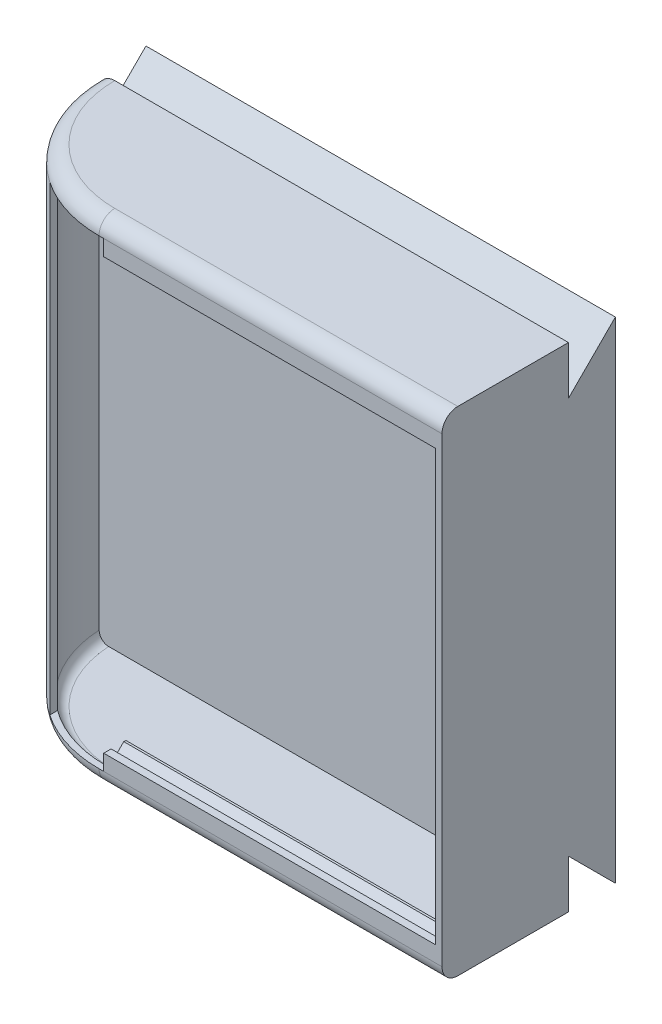
from build123d import *

# Parameters (mm, degrees)
SKETCH1_W            = 148.500856602
SKETCH1_H            = 156
BOSS_EXTRUDE1_DEPTH  = 40
FILLET3_R            = 40
FILLET4_R            = 5
SHELL4_T             = -2
SKETCH19_W           = 131
SKETCH19_H           = 146
CUT_EXTRUDE8_DEPTH   = 10
SKETCH21_W           = 107
SKETCH21_H           = 2
BOSS_EXTRUDE7_DEPTH  = 5
BOSS_EXTRUDE8_START  = -107
BOSS_EXTRUDE8_DEPTH  = 107
CUT_EXTRUDE9_DEPTH   = 107
BOSS_EXTRUDE9_DEPTH  = 2
BOSS_EXTRUDE10_DEPTH = 15
CUT_EXTRUDE10_DEPTH  = 170
SHELL5_START         = -57.680419874
SHELL5_DEPTH         = 103
SKETCH29_W           = 7.658063704
SKETCH29_H           = 119.773909492
CUT_EXTRUDE11_DEPTH  = 170
SKETCH31_W           = 7.658063704
SKETCH31_H           = 119.773909492
BOSS_EXTRUDE12_DEPTH = 2
SKETCH32_W           = 7.658063704
SKETCH32_H           = 119.773909492
BOSS_EXTRUDE13_DEPTH = 2
CUT_EXTRUDE12_DEPTH  = 154


# Read off the part's stored shape, not the designer's step: Shell5
# Some blends are built 0.0001 mm under size
with BuildPart() as part:
    # Sketch1 → Boss-Extrude1 (new body)
    with BuildSketch(Plane.XY):
        with Locations((-26.930848175, -80)):
            Rectangle(SKETCH1_W, SKETCH1_H)
    extrude(amount=BOSS_EXTRUDE1_DEPTH)

    # Fillet3
    fillet3_edges = [part.edges().sort_by_distance(p)[0] for p in [
        (-101.181276476, -80, 40),
    ]]
    fillet(fillet3_edges, radius=FILLET3_R - 0.0001)  # a hair under: the kernel refuses the full size

    # Fillet4
    # the kernel refuses this fillet: 5 mm, written as the material it takes off along each edge
    with BuildSketch(Plane(origin=(-61.181376476, -158, 40), x_dir=(0, 1, 0), z_dir=(1, 0, 0))) as fillet4_piece_1:
        with BuildLine():
            CenterArc((FILLET4_R, -FILLET4_R), FILLET4_R, 90, 90)
            Line((0, -FILLET4_R), (0, 0))
            Line((0, 0), (FILLET4_R, 0))
        make_face()
    extrude(amount=121.000956602, mode=Mode.SUBTRACT)
    with BuildSketch(Plane(origin=(-61.181376476, -158, 0.0001), x_dir=(-1, 0, 0), z_dir=(0, 0, -1))) as fillet4_piece_2:
        with BuildLine():
            CenterArc((39.9999 - FILLET4_R, FILLET4_R), FILLET4_R, 270, 90)
            Line((39.9999 - FILLET4_R, 0), (39.9999, 0))
            Line((39.9999, 0), (39.9999, FILLET4_R))
        make_face()
    revolve(axis=Axis((-61.181376476, -158, 0.0001), (0, 1, 0)), revolution_arc=90, mode=Mode.SUBTRACT)
    with BuildSketch(Plane(origin=(-61.181376476, -2, 0.0001), x_dir=(-1, 0, 0), z_dir=(0, 0, -1))) as fillet4_piece_3:
        with BuildLine():
            CenterArc((39.9999 - FILLET4_R, -FILLET4_R), FILLET4_R, 0, 90)
            Line((39.9999, -FILLET4_R), (39.9999, 0))
            Line((39.9999, 0), (39.9999 - FILLET4_R, 0))
        make_face()
    revolve(axis=Axis((-61.181376476, -2, 0.0001), (0, 1, 0)), revolution_arc=90, mode=Mode.SUBTRACT)
    with BuildSketch(Plane(origin=(59.819580126, -2, 40), x_dir=(0, 0, -1), z_dir=(-1, 0, 0))) as fillet4_piece_4:
        with BuildLine():
            CenterArc((FILLET4_R, FILLET4_R), FILLET4_R, 180, 90)
            Line((0, FILLET4_R), (0, 0))
            Line((0, 0), (FILLET4_R, 0))
        make_face()
    extrude(amount=121.000956602, mode=Mode.SUBTRACT)
    with BuildSketch(Plane(origin=(-101.181276476, -2, -12.5), x_dir=(1, 0, 0), z_dir=(0, 0, 1)), Plane(origin=(-101.181276476, -158, -12.5), x_dir=(0, 1, 0), z_dir=(0, 0, 1))) as fillet4_piece_5:
        with BuildLine():
            CenterArc((FILLET4_R, -FILLET4_R), FILLET4_R, 90, 90)
            Line((0, -FILLET4_R), (0, 0))
            Line((0, 0), (FILLET4_R, 0))
        make_face()
    extrude(amount=12.5001, mode=Mode.SUBTRACT)

    # Shell4
    shell4_openings = [part.faces().sort_by_distance(p)[0] for p in [
        (47.319580126, -80, 19.967473228),
    ]]
    offset(amount=SHELL4_T, openings=shell4_openings)

    # Sketch19 → Cut-Extrude8 (cut)
    with BuildSketch(Plane.XY.offset(40)):
        with Locations((-18.180419874, -80)):
            Rectangle(SKETCH19_W, SKETCH19_H)
    extrude(amount=-CUT_EXTRUDE8_DEPTH, mode=Mode.SUBTRACT)

    # Sketch21 → Boss-Extrude7 (add)
    with BuildSketch(Plane(origin=(0, -153, 0), x_dir=(1, 0, 0), z_dir=(0, 1, 0))):
        with Locations((-6.180419874, -39)):
            Rectangle(SKETCH21_W, SKETCH21_H)
    boss_extrude7 = extrude(amount=BOSS_EXTRUDE7_DEPTH)

    # Sketch22 → Boss-Extrude8 (add)
    with BuildSketch(Plane(origin=(47.319580126, 0, 0), x_dir=(0, 0, -1), z_dir=(1, 0, 0)).offset(BOSS_EXTRUDE8_START)):
        with BuildLine():
            Line((-38, -148), (-33, -148))
            Line((-33, -148), (-33, -156))
            Line((-33, -156), (-35, -156))
            ThreePointArc((-35, -156), (-37.121320344, -155.121320344), (-38, -153))
            Line((-38, -153), (-38, -148))
        make_face()
    boss_extrude8 = extrude(amount=BOSS_EXTRUDE8_DEPTH)

    # Sketch23 → Cut-Extrude9 (cut)
    with BuildSketch(Plane(origin=(47.319580126, 0, 0), x_dir=(0, 0, -1), z_dir=(1, 0, 0))):
        Polygon((-37.667948512, -148), (-37.667948512, -152.05), (-33.667948512, -148), align=None)
    cut_extrude9 = extrude(amount=-CUT_EXTRUDE9_DEPTH, mode=Mode.SUBTRACT)

    # Mirror1: Boss-Extrude7, Boss-Extrude8, Cut-Extrude9 across plane
    add(boss_extrude7.mirror(Plane.ZX.offset(-80)))
    add(boss_extrude8.mirror(Plane.ZX.offset(-80)))
    add(cut_extrude9.mirror(Plane.ZX.offset(-80)), mode=Mode.SUBTRACT)

    # Sketch25 → Boss-Extrude9 (add)
    with BuildSketch(Plane(origin=(47.319580126, 0, 0), x_dir=(0, 0, -1), z_dir=(1, 0, 0))):
        Polygon((-40, -148), (-37.667948512, -148), (-37.667948512, -152.05), (-33.667948512, -148), (-33, -148), (-33, -156), (-2, -156), (-2, -4), (-33, -4), (-33, -12), (-33.667948512, -12), (-37.667948512, -7.95), (-37.667948512, -12), (-40, -12), align=None)
    extrude(amount=-BOSS_EXTRUDE9_DEPTH)

    # Sketch26 → Boss-Extrude10 (add)
    with BuildSketch(Plane(origin=(0, 0, 0), x_dir=(-1, 0, 0), z_dir=(0, 0, -1))):
        Polygon((101.181276476, -7), (101.181276476, -153), (101.181276476, -158), (96.181276476, -158), (-47.319580126, -158), (-47.319580126, -2), (96.181276476, -2), (101.181276476, -2), align=None)
    extrude(amount=BOSS_EXTRUDE10_DEPTH)

    # Sketch27 → Cut-Extrude10 (cut)
    with BuildSketch(Plane.ZY.offset(101.181276476)):
        Polygon((-15.241421356, -1.9), (0, -1.9), (0, -2), (0, -17), (0, -17.141421356), align=None)
        Polygon((0, -142.858578644), (-15.241421356, -158.1), (0, -158.1), (0, -158), (0, -143), align=None)
    extrude(amount=-CUT_EXTRUDE10_DEPTH, mode=Mode.SUBTRACT)

    # Shell5 outline → Shell5 (cut)
    with BuildSketch(Plane.YZ.offset(SHELL5_START)):
        with BuildLine():
            Line((-152.194861825, 35), (-154.69858558, 37.472813585))
            ThreePointArc((-154.69858558, 37.472813585), (-155.654784053, 36.397183463), (-156, 35))
            Line((-156, 35), (-152.194861825, 35))
        make_face()
    extrude(amount=SHELL5_DEPTH, mode=Mode.SUBTRACT)

    # Sketch29 → Cut-Extrude11 (cut)
    with BuildSketch(Plane.ZY.offset(101.181276476)):
        with Locations((-8.13310084, -80.031899357)):
            Rectangle(SKETCH29_W, SKETCH29_H)
    extrude(amount=-CUT_EXTRUDE11_DEPTH, mode=Mode.SUBTRACT)

    # Sketch31 → Boss-Extrude12 (add)
    with BuildSketch(Plane(origin=(47.319580126, 0, 0), x_dir=(0, 0, -1), z_dir=(1, 0, 0))):
        with Locations((8.13310084, -80.031899357)):
            Rectangle(SKETCH31_W, SKETCH31_H)
    extrude(amount=-BOSS_EXTRUDE12_DEPTH)

    # Sketch32 → Boss-Extrude13 (add)
    with BuildSketch(Plane.ZY.offset(101.181276476)):
        with Locations((-8.13310084, -80.031899357)):
            Rectangle(SKETCH32_W, SKETCH32_H)
    extrude(amount=-BOSS_EXTRUDE13_DEPTH)

    # Sketch33 → Cut-Extrude12 (cut)
    with BuildSketch(Plane.ZY.offset(101.181276476)):
        Polygon((0, -17.141421356), (0, -17.291421356), (-14.85, -2.441421356), (-14.85, -13.62364303), (-14.85, -146.37635697), (-14.85, -157.558578644), (0, -142.708578644), (0, -142.858578644), (-15, -157.858578644), (-15, -2.141421356), align=None)
    extrude(amount=-CUT_EXTRUDE12_DEPTH, mode=Mode.SUBTRACT)


solid = part.part
